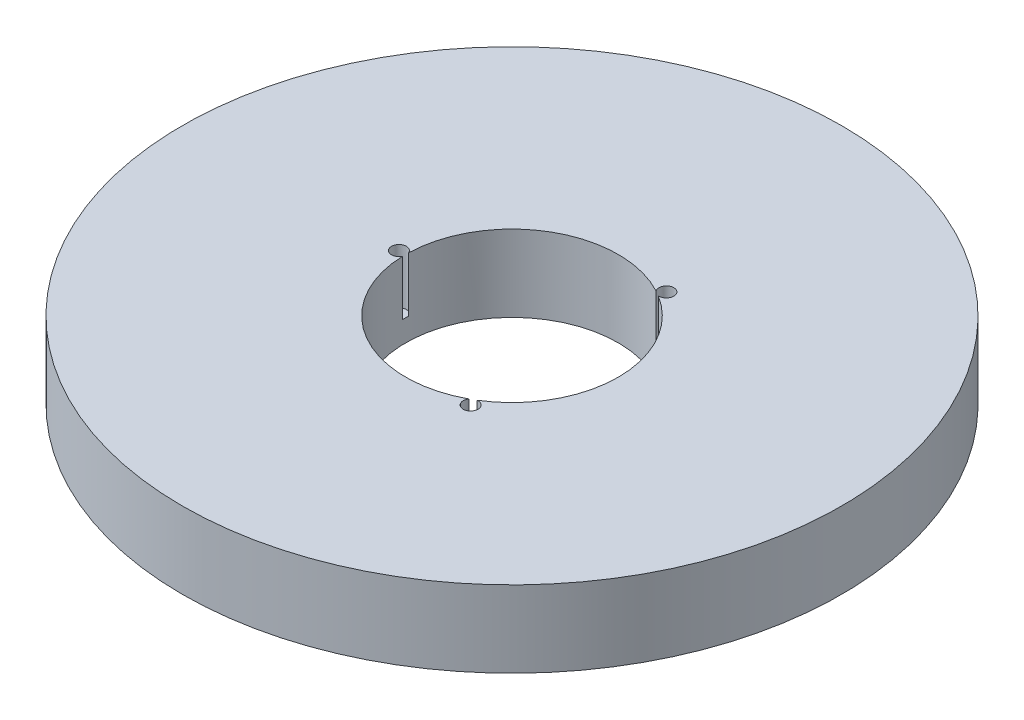
from build123d import *

# Parameters (mm, degrees)
SKETCH1_R           = 77.5
BOSS_EXTRUDE1_DEPTH = 18
SKETCH2_R           = 25
CUT_EXTRUDE1_DEPTH  = 112.069797875
SKETCH3_R           = 1.743489704
CUT_EXTRUDE2_DEPTH  = 12.889079035
CIRPATTERN1_COUNT   = 3


with BuildPart() as part:
    # Sketch1 → Boss-Extrude1 (new body)
    with BuildSketch(Plane(origin=(0, 0, 0), x_dir=(1, 0, 0), z_dir=(0, 1, 0))):
        Circle(SKETCH1_R)
    extrude(amount=BOSS_EXTRUDE1_DEPTH)

    # Sketch2 → Cut-Extrude1 (cut, through all)
    with BuildSketch(Plane(origin=(0, 0, 0), x_dir=(1, 0, 0), z_dir=(0, 1, 0))):
        Circle(SKETCH2_R)
    extrude(amount=CUT_EXTRUDE1_DEPTH, mode=Mode.SUBTRACT)

    # Sketch3 → Cut-Extrude2 (cut)
    with BuildSketch(Plane(origin=(0, 18, 0), x_dir=(1, 0, 0), z_dir=(0, 1, 0))):
        with Locations((-26.583649097, 0)):
            Circle(SKETCH3_R)
    cut_extrude2 = extrude(amount=-CUT_EXTRUDE2_DEPTH, mode=Mode.SUBTRACT)

    # CirPattern1: Cut-Extrude2 ×3 about axis
    cirpattern1_axis = Axis((0, 0, 0), (0, 1, 0))
    for i in range(1, CIRPATTERN1_COUNT):
        add(cut_extrude2.rotate(cirpattern1_axis, i * 360 / CIRPATTERN1_COUNT), mode=Mode.SUBTRACT)


solid = part.part
